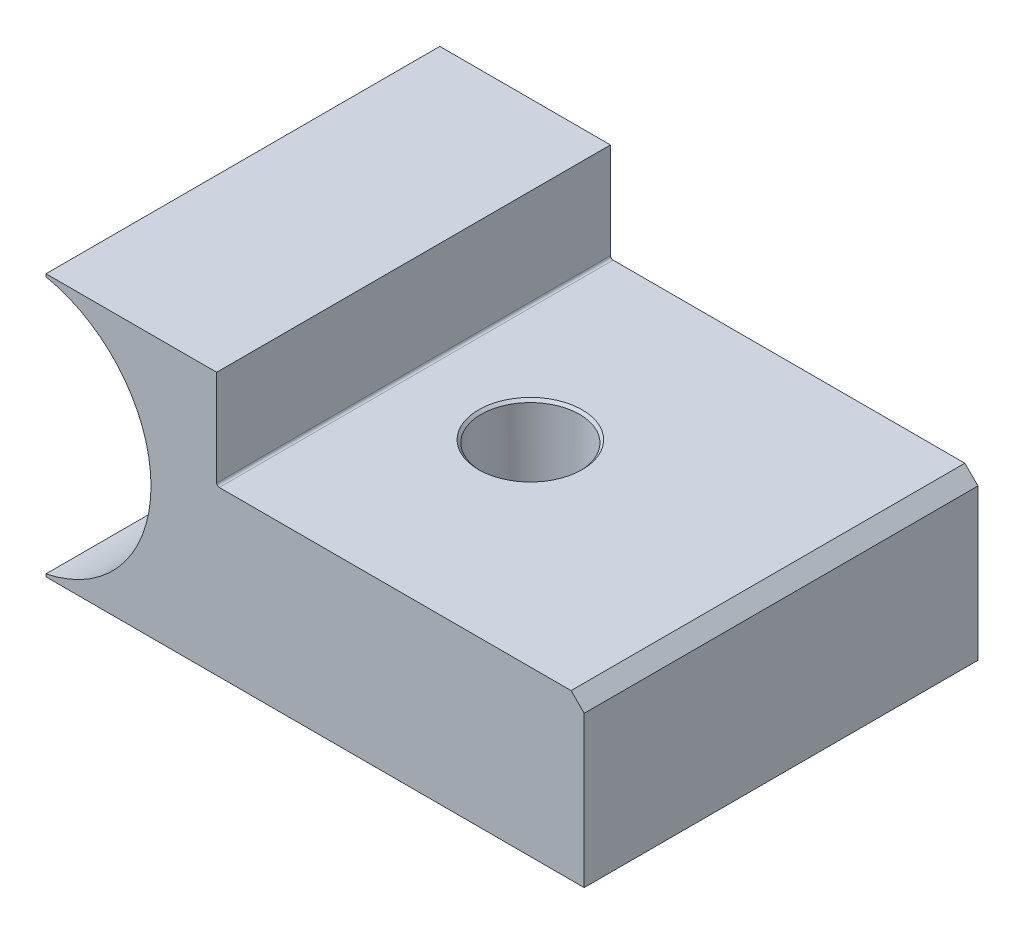
from build123d import *

# Parameters (mm, degrees)
BOSS_EXTRUDE1_DEPTH          = 38.1
F_3_8_0_375_DIAMETER_HOLE1_D = 9.525
CHAMFER1_SIZE                = 1.27
CHAMFER2_SIZE                = 0.254
FILLET1_R                    = 0.254


with BuildPart() as part:
    # Sketch1 → Boss-Extrude1 (new body)
    with BuildSketch(Plane.XY):
        with BuildLine():
            Line((2.54, 0), (54.61, 0))
            Line((54.61, 0), (54.61, 15.875))
            Line((54.61, 15.875), (19.05, 15.875))
            Line((19.05, 15.875), (19.05, 25.4))
            Line((19.05, 25.4), (2.54, 25.4))
            Line((2.54, 25.4), (2.54, 25.143407893))
            ThreePointArc((2.54, 25.143407893), (12.7, 12.7), (2.54, 0.256592107))
            Line((2.54, 0.256592107), (2.54, 0))
        make_face()
    extrude(amount=BOSS_EXTRUDE1_DEPTH)

    # 3/8 (0.375) Diameter Hole1 (through all)
    with Locations(Plane(origin=(0, 15.875, 0), x_dir=(1, 0, 0), z_dir=(0, 1, 0))):
        with Locations((30.353, -19.05)):
            Hole(F_3_8_0_375_DIAMETER_HOLE1_D / 2)

    # Chamfer1
    chamfer1_edges = [part.edges().sort_by_distance(p)[0] for p in [
        (54.61, 15.875, 19.05),
    ]]
    chamfer(chamfer1_edges, length=CHAMFER1_SIZE)

    # Chamfer2
    chamfer2_edges = [part.edges().sort_by_distance(p)[0] for p in [
        (35.1155, 15.875, 19.05),
    ]]
    chamfer(chamfer2_edges, length=CHAMFER2_SIZE)

    # Fillet1
    fillet1_edges = [part.edges().sort_by_distance(p)[0] for p in [
        (19.05, 15.875, 19.05),
    ]]
    fillet(fillet1_edges, radius=FILLET1_R)


solid = part.part
